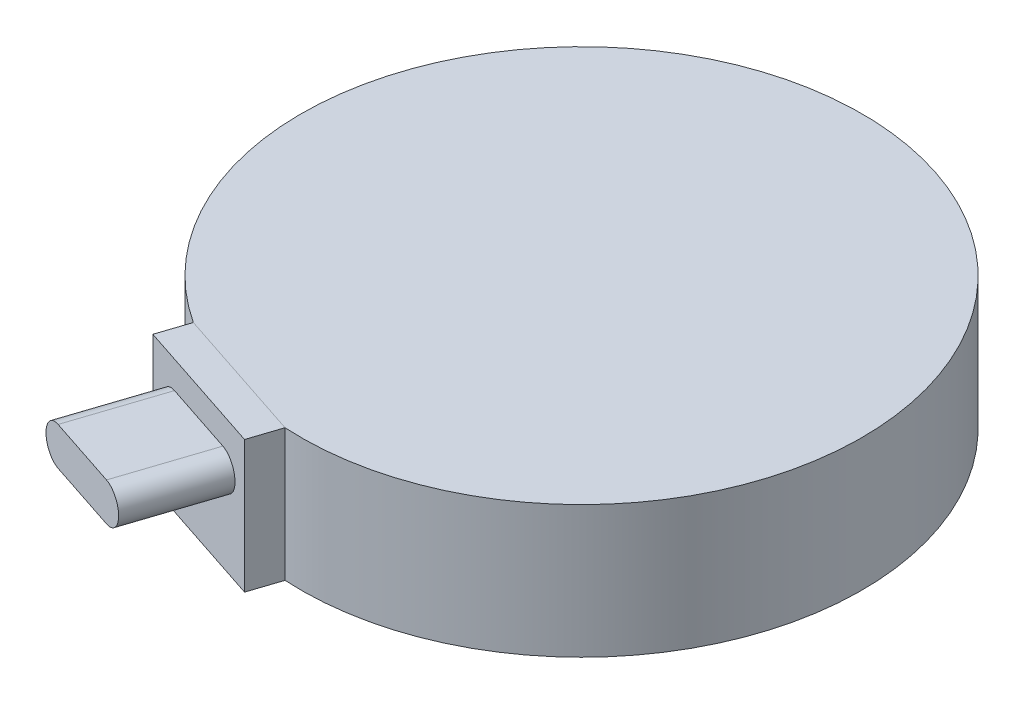
from build123d import *

# Parameters (mm, degrees)
SKETCH1_R           = 70
BOSS_EXTRUDE1_DEPTH = 33
SKETCH4_W           = 36
SKETCH4_H           = 33.003390547
BOSS_EXTRUDE2_DEPTH = 8
BOSS_EXTRUDE3_DEPTH = 23
SKETCH10_R          = 13.35
CUT_EXTRUDE1_DEPTH  = 14
CHAMFER2_SIZE       = 6


with BuildPart() as part:
    # Sketch1 → Boss-Extrude1 (new body)
    with BuildSketch(Plane(origin=(0, 0, 0), x_dir=(1, 0, 0), z_dir=(0, 1, 0))):
        Circle(SKETCH1_R)
    extrude(amount=BOSS_EXTRUDE1_DEPTH)

    # Sketch4 → Boss-Extrude2 (add)
    with BuildSketch(Plane(origin=(-21.221579415, 0, 64.231180646), x_dir=(0.9495173331200061, 0, 0.3137145742624522), z_dir=(-0.3137145742624522, 0, 0.9495173331200061))):
        with Locations((0, 16.501695274)):
            Rectangle(SKETCH4_W, SKETCH4_H)
    extrude(amount=BOSS_EXTRUDE2_DEPTH)

    # Sketch7 → Boss-Extrude3 (add)
    with BuildSketch(Plane(origin=(-23.731296009, 0, 71.827319311), x_dir=(0.9495173331200061, 0, 0.3137145742624523), z_dir=(-0.3137145742624523, 0, 0.9495173331200061))):
        with BuildLine():
            Line((-9.5, 26.2), (9.5, 26.2))
            ThreePointArc((9.5, 26.2), (14.25, 21.45), (9.5, 16.7))
            Line((9.5, 16.7), (-9.5, 16.7))
            ThreePointArc((-9.5, 16.7), (-14.25, 21.45), (-9.5, 26.2))
        make_face()
    extrude(amount=BOSS_EXTRUDE3_DEPTH)

    # Sketch10 → Cut-Extrude1 (cut)
    with BuildSketch(Plane.XZ):
        Circle(SKETCH10_R)
    extrude(amount=-CUT_EXTRUDE1_DEPTH, mode=Mode.SUBTRACT)

    # Chamfer2
    chamfer2_edges = [part.edges().sort_by_distance(p)[0] for p in [
        (-13.35, 0, 0),
    ]]
    chamfer(chamfer2_edges, length=CHAMFER2_SIZE)


solid = part.part
